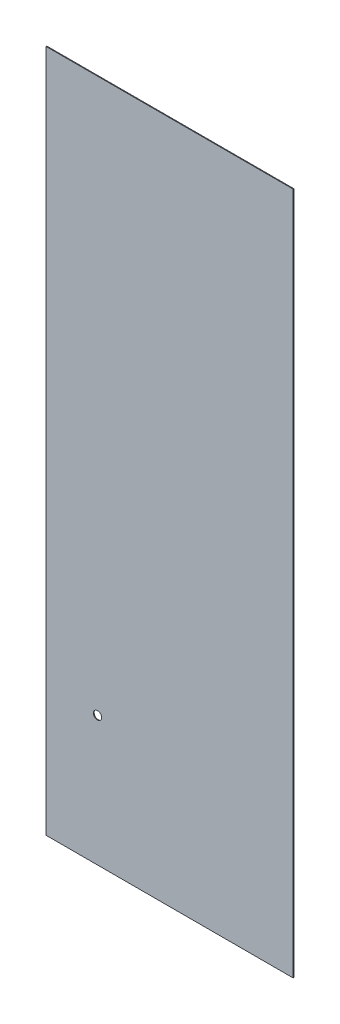
from build123d import *

# Parameters (mm, degrees)
SKETCH1_W          = 240
SKETCH1_H          = 663.4
BASE_FLANGE1_DEPTH = 0.7
SKETCH2_R          = 4
CUT_EXTRUDE1_DEPTH = 10


# Sheet-metal steps are written as plain solids
with BuildPart() as part:
    # Sketch1 → Base-Flange1 (new body)
    with BuildSketch(Plane.XY):
        with Locations((120, 331.7)):
            Rectangle(SKETCH1_W, SKETCH1_H)
    extrude(amount=-BASE_FLANGE1_DEPTH)

    # Sketch2 → Cut-Extrude1 (cut)
    with BuildSketch(Plane(origin=(0, 0, -0.7), x_dir=(-1, 0, 0), z_dir=(0, 0, -1))):
        with Locations((-50, 125.84)):
            Circle(SKETCH2_R)
    extrude(amount=-CUT_EXTRUDE1_DEPTH, mode=Mode.SUBTRACT)


solid = part.part
